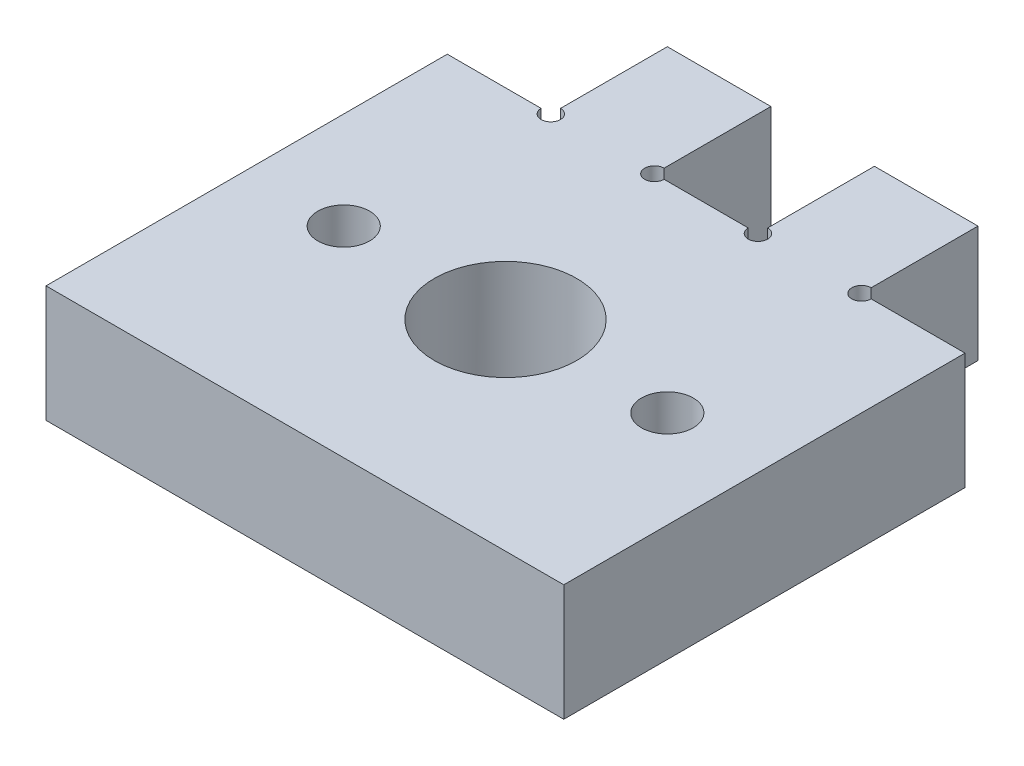
from build123d import *

# Parameters (mm, degrees)
SKETCH1_R           = 4
BOSS_EXTRUDE1_DEPTH = 18
CUT_EXTRUDE1_REACH  = 67.765
SKETCH2_R           = 11
SKETCH3_R           = 1.5
CUT_EXTRUDE2_DEPTH  = 66.76473219


with BuildPart() as part:
    # Sketch1 → Boss-Extrude1 (new body)
    with BuildSketch(Plane(origin=(0, 0, 0), x_dir=(1, 0, 0), z_dir=(0, 1, 0))):
        Polygon((-40, 31), (-24, 31), (-24, 49), (-8, 49), (-8, 31), (8, 31), (8, 49), (24, 49), (24, 31), (40, 31), (40, -31), (-40, -31), align=None)
        Circle(SKETCH1_R, mode=Mode.SUBTRACT)
        with Locations((25, 0)):
            Circle(SKETCH1_R, mode=Mode.SUBTRACT)
        with Locations((-25, 0)):
            Circle(SKETCH1_R, mode=Mode.SUBTRACT)
    extrude(amount=BOSS_EXTRUDE1_DEPTH)

    # Sketch2 → Cut-Extrude1 (cut, up to next)
    with BuildSketch(Plane(origin=(0, 18, 0), x_dir=(1, 0, 0), z_dir=(0, 1, 0)), mode=Mode.PRIVATE) as cut_extrude1_sk1:
        Circle(SKETCH2_R)
    cut_extrude1_tool1 = extrude(cut_extrude1_sk1.sketch, amount=-CUT_EXTRUDE1_REACH, mode=Mode.PRIVATE) & part.part
    add(cut_extrude1_tool1.solids().sort_by_distance((0, 18, 0))[0], mode=Mode.SUBTRACT)

    # Sketch3 → Cut-Extrude2 (cut, through all)
    with BuildSketch(Plane(origin=(0, 18, 0), x_dir=(1, 0, 0), z_dir=(0, 1, 0))):
        with Locations((-24, 31)):
            Circle(SKETCH3_R)
        with Locations((-8, 31)):
            Circle(SKETCH3_R)
        with Locations((8, 31)):
            Circle(SKETCH3_R)
        with Locations((24, 31)):
            Circle(SKETCH3_R)
    extrude(amount=-CUT_EXTRUDE2_DEPTH, mode=Mode.SUBTRACT)


solid = part.part
